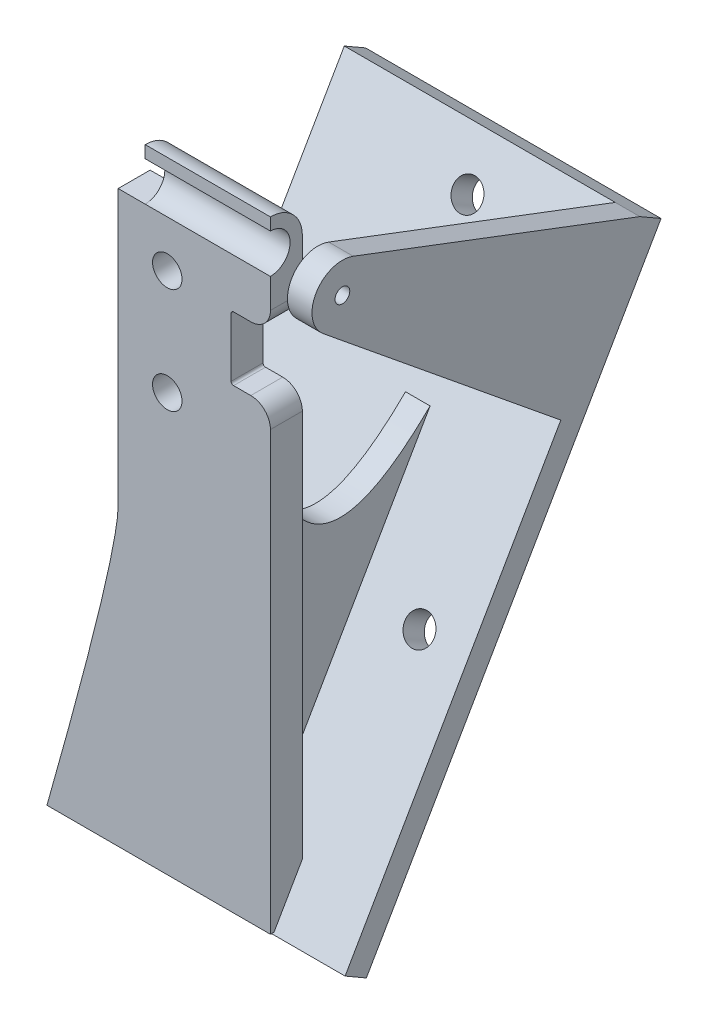
from build123d import *

# Parameters (mm, degrees)
BOSS_EXTRUDE1_DEPTH = 6.5
SKETCH2_W           = 60.158889846
SKETCH2_H           = 120
BOSS_EXTRUDE3_DEPTH = 5
SKETCH6_R           = 3
CUT_EXTRUDE7_DEPTH  = 5.1
BOSS_EXTRUDE4_DEPTH = 31
CUT_EXTRUDE8_REACH  = 119.187
SKETCH11_W          = 5.5
SKETCH11_H          = 10.5
CUT_EXTRUDE11_REACH = 119.187
SKETCH14_R          = 3
SKETCH29_R          = 1.5
BOSS_EXTRUDE6_DEPTH = 5
RIB6_START          = -2.5
RIB6_DEPTH          = 5
CUT_EXTRUDE14_REACH = 118.769
CUT_EXTRUDE15_REACH = 119.187
SKETCH66_W          = 8
SKETCH66_H          = 13
FILLET3_R           = 4
FILLET4_R           = 0.5


# Read off the part's stored shape, not the designer's step: Rib6
with BuildPart() as part:
    # Sketch1 → Boss-Extrude1 (new body)
    with BuildSketch(Plane.XY):
        with BuildLine():
            Line((-15.5, -30), (-15.5, 30))
            Line((-15.5, 30), (15.5, 30))
            Line((15.5, 30), (15.5, -30))
            Line((15.5, -30), (15.5, -90))
            Line((15.5, -90), (-30, -90))
            add(Edge.make_bspline(
                [(-15.5, -30), (-15.682751911, -39.304401058), (-30, -90)],
                knots=[0.243669215, 0.243669215, 0.243669215, 1, 1, 1], degree=2))
        make_face()
    extrude(amount=BOSS_EXTRUDE1_DEPTH)

    # Sketch2 → Boss-Extrude3 (add)
    with BuildSketch(Plane(origin=(0, -22.5, -38.97114317), x_dir=(1, 0, 0), z_dir=(0, 0.500000000000001, 0.866025403784438))):
        with Locations((0.079444923, -21.192286341)):
            Rectangle(SKETCH2_W, SKETCH2_H)
    extrude(amount=BOSS_EXTRUDE3_DEPTH)

    # Sketch6 → Cut-Extrude7 (cut)
    with BuildSketch(Plane(origin=(0, -22.5, -38.97114317), x_dir=(-1, 0, 0), z_dir=(0, -0.5000000000000012, -0.866025403784438))):
        with Locations(Location((-20.158889846, -30.893082241, 0), (0, 0, 90))):
            Circle(SKETCH6_R)
        with Locations(Location((20, -30.893082241, 0), (0, 0, 90))):
            Circle(SKETCH6_R)
        with Locations(Location((-0.079444923, 28.807713659, 0), (0, 0, 90))):
            Circle(SKETCH6_R)
    extrude(amount=-CUT_EXTRUDE7_DEPTH, mode=Mode.SUBTRACT)

    # Sketch10 → Boss-Extrude4 (add)
    with BuildSketch(Plane(origin=(15.5, 0, 0), x_dir=(0, 0, -1), z_dir=(1, 0, 0))):
        with BuildLine():
            Line((-6.5, 36.5), (-6.5, 30))
            Line((-6.5, 30), (0, 30))
            ThreePointArc((0, 30), (-1.903805922, 34.596194078), (-6.5, 36.5))
        make_face()
    extrude(amount=-BOSS_EXTRUDE4_DEPTH)

    # Sketch11 → Cut-Extrude8 (cut, up to next)
    with BuildSketch(Plane.XY.offset(6.5), mode=Mode.PRIVATE) as cut_extrude8_sk1:
        with Locations((-12.75, 31.25)):
            Rectangle(SKETCH11_W, SKETCH11_H)
    cut_extrude8_tool1 = extrude(cut_extrude8_sk1.sketch, amount=-CUT_EXTRUDE8_REACH, mode=Mode.PRIVATE) & part.part
    add(cut_extrude8_tool1.solids().sort_by_distance((-12.75, 31.25, 6.5))[0], mode=Mode.SUBTRACT)

    # Sketch14 → Cut-Extrude11 (cut, up to next)
    with BuildSketch(Plane.XY.offset(6.5), mode=Mode.PRIVATE) as cut_extrude11_sk1:
        with Locations((-5.5, 16.5)):
            Circle(SKETCH14_R)
    cut_extrude11_tool1 = extrude(cut_extrude11_sk1.sketch, amount=-CUT_EXTRUDE11_REACH, mode=Mode.PRIVATE) & part.part
    # Sketch14 → Cut-Extrude11 (cut, up to next)
    with BuildSketch(Plane.XY.offset(6.5), mode=Mode.PRIVATE) as cut_extrude11_sk2:
        with Locations((-5.5, -5)):
            Circle(SKETCH14_R)
    cut_extrude11_tool2 = extrude(cut_extrude11_sk2.sketch, amount=-CUT_EXTRUDE11_REACH, mode=Mode.PRIVATE) & part.part
    add(cut_extrude11_tool1.solids().sort_by_distance((-5.5, 16.5, 6.5))[0], mode=Mode.SUBTRACT)
    add(cut_extrude11_tool2.solids().sort_by_distance((-5.5, -5, 6.5))[0], mode=Mode.SUBTRACT)

    # Sketch29 → Boss-Extrude6 (add)
    with BuildSketch(Plane(origin=(30.158889846, 0, 0), x_dir=(0, 0, -1), z_dir=(1, 0, 0))):
        with BuildLine():
            Line((-4.298836218, 35.789748924), (54.044872981, 13.608465892))
            Line((54.044872981, 13.608465892), (37.966397208, -14.240271055))
            Line((37.966397208, -14.240271055), (-10.413719231, 25.199050471))
            ThreePointArc((-10.413719231, 25.199050471), (-11.864134131, 33.0971567), (-4.298836218, 35.789748924))
        make_face()
        with Locations(Location((-6.5, 30, 0), (0, 0, 90))):
            Circle(SKETCH29_R, mode=Mode.SUBTRACT)
    extrude(amount=-BOSS_EXTRUDE6_DEPTH)

    # Rib6 outline → Rib6 (add)
    with BuildSketch(Plane(origin=(5, 0, 0), x_dir=(0, 0, -1), z_dir=(1, 0, 0)).offset(RIB6_START)):
        with BuildLine():
            Line((0, -80), (34.010848977, -21.091481564))
            add(Edge.make_bspline(
                [(34.010848977, -21.091481564), (7.27651008, -47.405497337), (0, -7.927359395)],
                knots=[0, 0, 0, 1, 1, 1], degree=2))
            Line((0, -7.927359395), (0, -80))
        make_face()
    extrude(amount=RIB6_DEPTH)

    # Sketch65 → Cut-Extrude14 (cut, up to next)
    with BuildSketch(Plane.ZY.offset(10), mode=Mode.PRIVATE) as cut_extrude14_sk1:
        with BuildLine():
            Line((6.5, 34), (6.5, 26))
            ThreePointArc((6.5, 26), (2.5, 30), (6.5, 34))
        make_face()
    cut_extrude14_tool1 = extrude(cut_extrude14_sk1.sketch, amount=-CUT_EXTRUDE14_REACH, mode=Mode.PRIVATE) & part.part
    add(cut_extrude14_tool1.solids().sort_by_distance((-10, 30, 4.802347))[0], mode=Mode.SUBTRACT)

    # Sketch66 → Cut-Extrude15 (cut, up to next)
    with BuildSketch(Plane.XY.offset(6.5), mode=Mode.PRIVATE) as cut_extrude15_sk1:
        with Locations((11.5, 9.5)):
            Rectangle(SKETCH66_W, SKETCH66_H)
    cut_extrude15_tool1 = extrude(cut_extrude15_sk1.sketch, amount=-CUT_EXTRUDE15_REACH, mode=Mode.PRIVATE) & part.part
    add(cut_extrude15_tool1.solids().sort_by_distance((11.5, 9.5, 6.5))[0], mode=Mode.SUBTRACT)

    # Fillet3
    fillet3_edges = [part.edges().sort_by_distance(p)[0] for p in [
        (15.5, 16, 3.25),
        (15.5, 3, 3.25),
    ]]
    fillet(fillet3_edges, radius=FILLET3_R)

    # Fillet4
    fillet4_edges = [part.edges().sort_by_distance(p)[0] for p in [
        (7.5, 3, 3.25),
        (7.5, 16, 3.25),
    ]]
    fillet(fillet4_edges, radius=FILLET4_R)


solid = part.part
